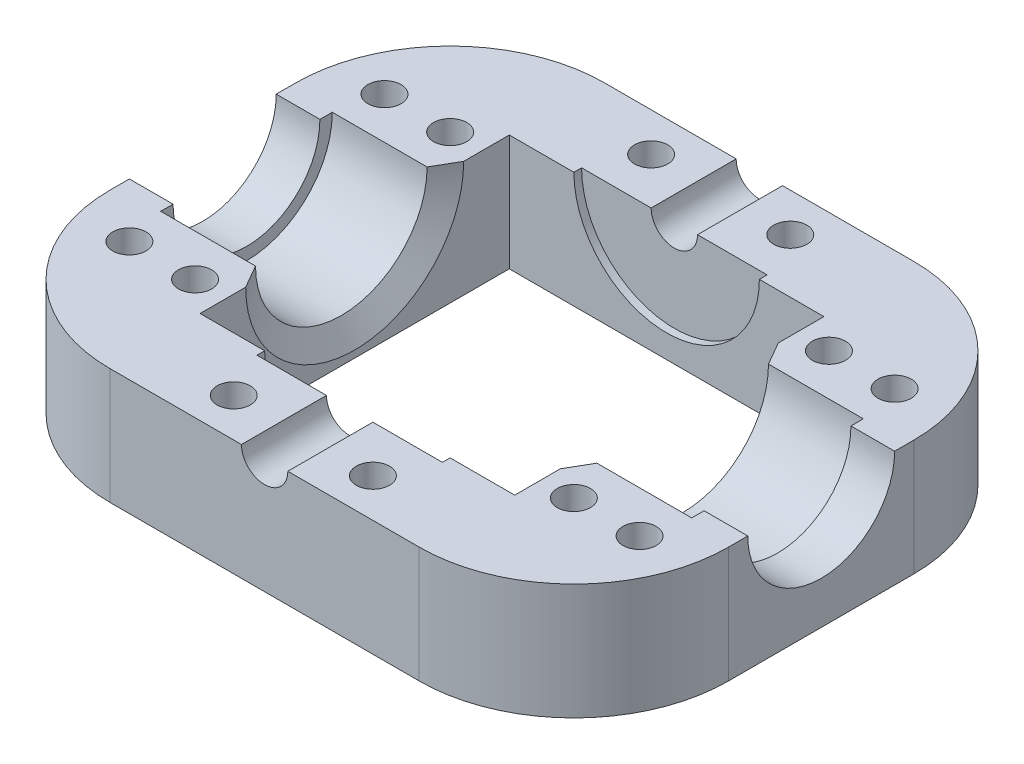
from build123d import *
from OCP.BRepFilletAPI import BRepFilletAPI_MakeChamfer

# Parameters (mm, degrees)
SKETCH1_W           = 80
SKETCH1_H           = 64
SKETCH1_W_2         = 40.7
SKETCH1_H_2         = 40
BOSS_EXTRUDE1_DEPTH = 15
SKETCH3_W           = 14
SKETCH3_H           = 11.1
SKETCH4_R           = 9.5
CUT_EXTRUDE2_DEPTH  = 88.458561616
SKETCH5_R           = 3
CUT_EXTRUDE3_DEPTH  = 77.948034413
SKETCH8_R           = 2.15
CUT_EXTRUDE6_DEPTH  = 54.37602458
FILLET1_R           = 20
CHAMFER1_SIZE       = 3
CHAMFER1_SIZE2      = 1.732050808
SKETCH9_W           = 12
SKETCH9_H           = 1


with BuildPart() as part:
    # Sketch1 → Boss-Extrude1 (new body)
    with BuildSketch(Plane(origin=(0, 0, 0), x_dir=(1, 0, 0), z_dir=(0, 1, 0))):
        Rectangle(SKETCH1_W, SKETCH1_H)
        Rectangle(SKETCH1_W_2, SKETCH1_H_2, mode=Mode.SUBTRACT)
    extrude(amount=BOSS_EXTRUDE1_DEPTH)

    # Sketch3 → Cut-Revolve1 (revolve, cut)
    with BuildSketch(Plane(origin=(0, 15, 0), x_dir=(1, 0, 0), z_dir=(0, 1, 0))):
        with Locations((27.35, -5.55)):
            Rectangle(SKETCH3_W, SKETCH3_H)
        with Locations((-27.35, -5.55)):
            Rectangle(SKETCH3_W, SKETCH3_H)
    revolve(axis=Axis((20.35, 15, 0), (1, 0, 0)), mode=Mode.SUBTRACT)

    # Sketch4 → Cut-Extrude2 (cut, through all)
    with BuildSketch(Plane(origin=(40, 0, 0), x_dir=(0, 0, -1), z_dir=(1, 0, 0))):
        with Locations((0, 15)):
            Circle(SKETCH4_R)
    extrude(amount=-CUT_EXTRUDE2_DEPTH, mode=Mode.SUBTRACT)

    # Sketch5 → Cut-Extrude3 (cut, through all)
    with BuildSketch(Plane.XY.offset(32)):
        with Locations((0, 15)):
            Circle(SKETCH5_R)
    extrude(amount=-CUT_EXTRUDE3_DEPTH, mode=Mode.SUBTRACT)

    # Sketch8 → Cut-Extrude6 (cut, through all)
    with BuildSketch(Plane(origin=(0, 15, 0), x_dir=(1, 0, 0), z_dir=(0, 1, 0))):
        with Locations((24.5, 16.5)):
            Circle(SKETCH8_R)
        with Locations((24.5, -16.5)):
            Circle(SKETCH8_R)
        with Locations((-24.5, -16.5)):
            Circle(SKETCH8_R)
        with Locations((-24.5, 16.5)):
            Circle(SKETCH8_R)
        with Locations((9, -27)):
            Circle(SKETCH8_R)
        with Locations((-9, -27)):
            Circle(SKETCH8_R)
        with Locations((-9, 27)):
            Circle(SKETCH8_R)
        with Locations((9, 27)):
            Circle(SKETCH8_R)
        with Locations((-33, 16.5)):
            Circle(SKETCH8_R)
        with Locations((33, 16.5)):
            Circle(SKETCH8_R)
        with Locations((33, -16.5)):
            Circle(SKETCH8_R)
        with Locations((-33, -16.5)):
            Circle(SKETCH8_R)
    extrude(amount=-CUT_EXTRUDE6_DEPTH, mode=Mode.SUBTRACT)

    # Fillet1
    fillet1_edges = [part.edges().sort_by_distance(p)[0] for p in [
        (-40, 7.5, 32),
        (-40, 7.5, -32),
        (40, 7.5, -32),
        (40, 7.5, 32),
    ]]
    fillet(fillet1_edges, radius=FILLET1_R)

    # Chamfer1: one chamfer whose edges measure the first distance from different faces: ONE call of the kernel's chamfer builder (chamfer() names one face for all edges)
    chamfer1_edges_1 = [part.edges().sort_by_distance(p)[0] for p in [
        (-20.35, 3.9, 0),
    ]]
    chamfer1_side_1 = [part.faces().sort_by_distance(p)[0] for p in [
        (-20.35, 0.427200187, 0),
    ]]
    chamfer1_edges_2 = [part.edges().sort_by_distance(p)[0] for p in [
        (20.35, 3.9, 0),
    ]]
    chamfer1_side_2 = [part.faces().sort_by_distance(p)[0] for p in [
        (20.35, 0.427200187, 0),
    ]]
    chamfer1 = BRepFilletAPI_MakeChamfer(part.part.solid().wrapped)
    for e in chamfer1_edges_1:
        chamfer1.Add(CHAMFER1_SIZE, CHAMFER1_SIZE2, e.wrapped, chamfer1_side_1[0].wrapped)  # the first distance lies on this face
    for e in chamfer1_edges_2:
        chamfer1.Add(CHAMFER1_SIZE, CHAMFER1_SIZE2, e.wrapped, chamfer1_side_2[0].wrapped)  # the first distance lies on this face
    add(Compound.cast(chamfer1.Shape()), mode=Mode.REPLACE)

    # Sketch9 → Cut-Revolve2 (revolve, cut)
    with BuildSketch(Plane(origin=(0, 15, 0), x_dir=(1, 0, 0), z_dir=(0, 1, 0))):
        with Locations((-6, -20.5)):
            Rectangle(SKETCH9_W, SKETCH9_H)
        with Locations((-6, 20.5)):
            Rectangle(SKETCH9_W, SKETCH9_H)
    revolve(axis=Axis((0, 15, -29.871415895), (0, 0, 1)), mode=Mode.SUBTRACT)


solid = part.part
